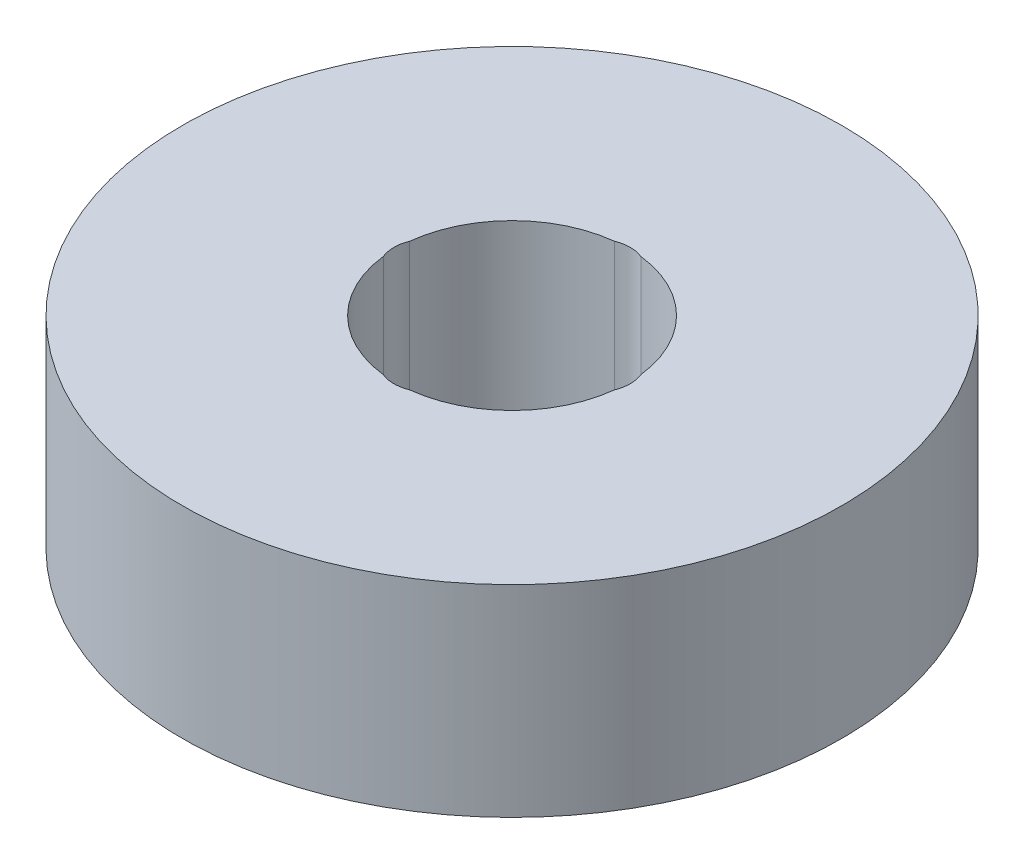
from build123d import *

# Parameters (mm, degrees)
SKETCH1_R           = 42.5
BOSS_EXTRUDE1_DEPTH = 26
SKETCH2_R           = 15
CUT_EXTRUDE1_DEPTH  = 66.486639859
SKETCH3_R           = 4.493949239
CUT_EXTRUDE2_DEPTH  = 25.395691023
CIRPATTERN1_COUNT   = 4


with BuildPart() as part:
    # Sketch1 → Boss-Extrude1 (new body)
    with BuildSketch(Plane(origin=(0, 0, 0), x_dir=(1, 0, 0), z_dir=(0, 1, 0))):
        Circle(SKETCH1_R)
    extrude(amount=BOSS_EXTRUDE1_DEPTH)

    # Sketch2 → Cut-Extrude1 (cut, through all)
    with BuildSketch(Plane(origin=(0, 0, 0), x_dir=(1, 0, 0), z_dir=(0, 1, 0))):
        Circle(SKETCH2_R)
    extrude(amount=CUT_EXTRUDE1_DEPTH, mode=Mode.SUBTRACT)

    # Sketch3 → Cut-Extrude2 (cut)
    with BuildSketch(Plane(origin=(0, 26, 0), x_dir=(1, 0, 0), z_dir=(0, 1, 0))):
        with Locations((-10.744170119, 0)):
            Circle(SKETCH3_R)
    cut_extrude2 = extrude(amount=-CUT_EXTRUDE2_DEPTH, mode=Mode.SUBTRACT)

    # CirPattern1: Cut-Extrude2 ×4 about axis
    cirpattern1_axis = Axis((0, 0, 0), (0, 1, 0))
    for i in range(1, CIRPATTERN1_COUNT):
        add(cut_extrude2.rotate(cirpattern1_axis, i * 360 / CIRPATTERN1_COUNT), mode=Mode.SUBTRACT)


solid = part.part
